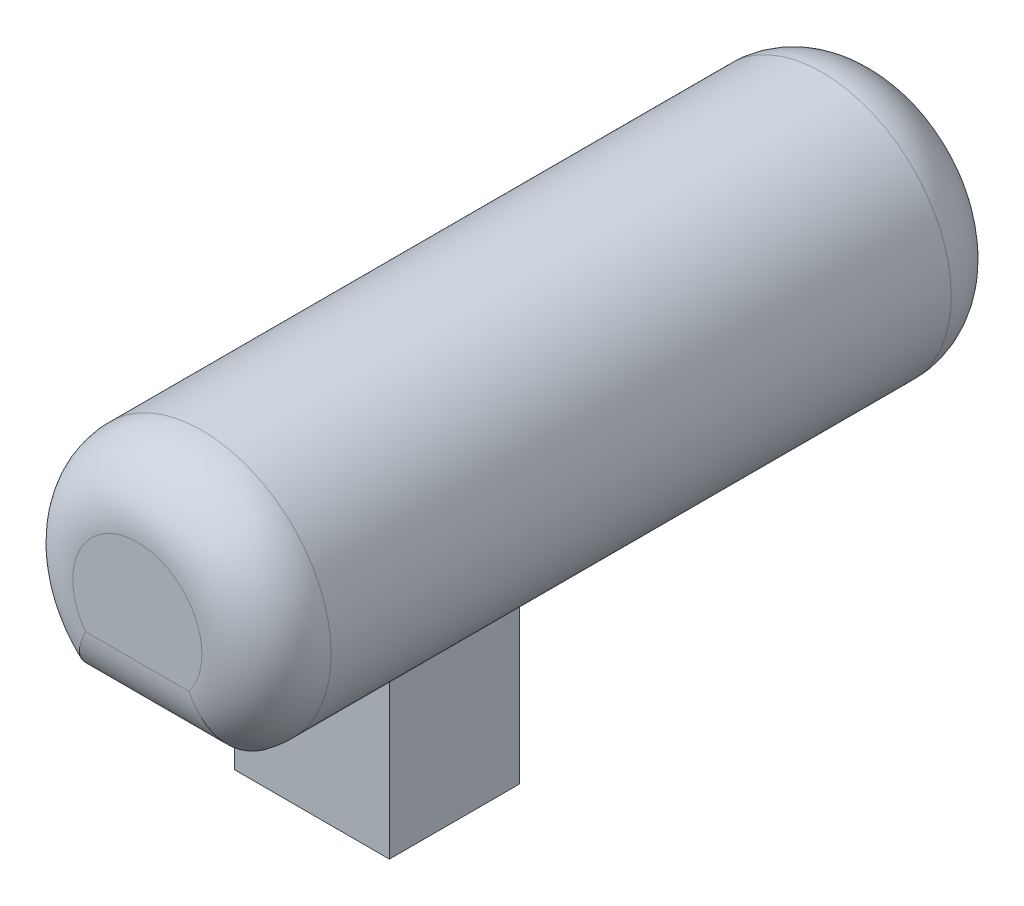
from build123d import *

# Parameters (mm, degrees)
SALIENTE_EXTRUIR1_DEPTH    = 29
CORTAR_EXTRUIR7_DEPTH      = 32.080540536
CORTAR_EXTRUIR7_DEPTH_BACK = 32.080540536
CROQUIS5_W                 = 6.75461664
CROQUIS5_H                 = 6
CORTAR_EXTRUIR8_DEPTH      = 32.701734968
CORTAR_EXTRUIR8_DEPTH_BACK = 32.701734968
CROQUIS9_W                 = 17.209263494
CROQUIS9_H                 = 6
REDONDEO3_R                = 2.5


with BuildPart() as part:
    # Croquis2 → Saliente-Extruir1 (new body)
    with BuildSketch(Plane.XY):
        with BuildLine():
            Line((-3, -4), (-3, -10))
            Line((-3, -10), (3, -10))
            Line((3, -10), (3, -4))
            ThreePointArc((3, -4), (0, 5), (-3, -4))
        make_face()
    extrude(amount=SALIENTE_EXTRUIR1_DEPTH)

    # Croquis5 → Cortar-Extruir7 (cut, two sides: drawn at the far end of the back side and taken through both)
    with BuildSketch(Plane(origin=(0, 0, 0), x_dir=(0, 0, -1), z_dir=(1, 0, 0)).offset(-CORTAR_EXTRUIR7_DEPTH_BACK)):
        with Locations((-25.62269168, -7)):
            Rectangle(CROQUIS5_W, CROQUIS5_H)
    extrude(amount=CORTAR_EXTRUIR7_DEPTH + CORTAR_EXTRUIR7_DEPTH_BACK, mode=Mode.SUBTRACT)

    # Croquis9 → Cortar-Extruir8 (cut, two sides: drawn at the far end of the back side and taken through both)
    with BuildSketch(Plane(origin=(3, 0, 0), x_dir=(0, 0, -1), z_dir=(1, 0, 0)).offset(-CORTAR_EXTRUIR8_DEPTH_BACK)):
        with Locations((-8.604631747, -7)):
            Rectangle(CROQUIS9_W, CROQUIS9_H)
    extrude(amount=CORTAR_EXTRUIR8_DEPTH + CORTAR_EXTRUIR8_DEPTH_BACK, mode=Mode.SUBTRACT)

    # Redondeo3
    # the kernel refuses this fillet: 2.5 mm, written as the material it takes off along each edge
    with BuildSketch(Plane(origin=(9.25, -4, 29), x_dir=(0, 0, -1), z_dir=(-1, 0, 0))) as redondeo3_piece_1:
        with BuildLine():
            CenterArc((REDONDEO3_R, -REDONDEO3_R), REDONDEO3_R, 90, 90)
            Line((0, -REDONDEO3_R), (0, 0))
            Line((0, 0), (REDONDEO3_R, 0))
        make_face()
    extrude(amount=18.5, mode=Mode.SUBTRACT)
    with BuildSketch(Plane(origin=(9.25, -4, 0), x_dir=(0, 0, 1), z_dir=(-1, 0, 0))) as redondeo3_piece_2:
        with BuildLine():
            CenterArc((REDONDEO3_R, REDONDEO3_R), REDONDEO3_R, 180, 90)
            Line((0, REDONDEO3_R), (0, 0))
            Line((0, 0), (REDONDEO3_R, 0))
        make_face()
    extrude(amount=18.5, mode=Mode.SUBTRACT)
    with BuildSketch(Plane(origin=(0, 0, 0), x_dir=(0.0031415874858798706, -0.9999950652018581, 0), z_dir=(-0.9999950652018581, -0.0031415874858798706, 0))) as redondeo3_piece_3:
        with BuildLine():
            CenterArc((5 - REDONDEO3_R, REDONDEO3_R), REDONDEO3_R, 270, 90)
            Line((5 - REDONDEO3_R, 0), (5, 0))
            Line((5, 0), (5, REDONDEO3_R))
        make_face()
    revolve(axis=Axis((0, 0, 0), (0, 0, 1)), revolution_arc=359.64, mode=Mode.SUBTRACT)
    with BuildSketch(Plane(origin=(0, 0, 29), x_dir=(0.0031415874858798706, -0.9999950652018581, 0), z_dir=(-0.9999950652018581, -0.0031415874858798706, 0))) as redondeo3_piece_4:
        with BuildLine():
            CenterArc((5 - REDONDEO3_R, -REDONDEO3_R), REDONDEO3_R, 0, 90)
            Line((5 - REDONDEO3_R, 0), (5, 0))
            Line((5, 0), (5, -REDONDEO3_R))
        make_face()
    revolve(axis=Axis((0, 0, 29), (0, 0, 1)), revolution_arc=359.64, mode=Mode.SUBTRACT)


solid = part.part
